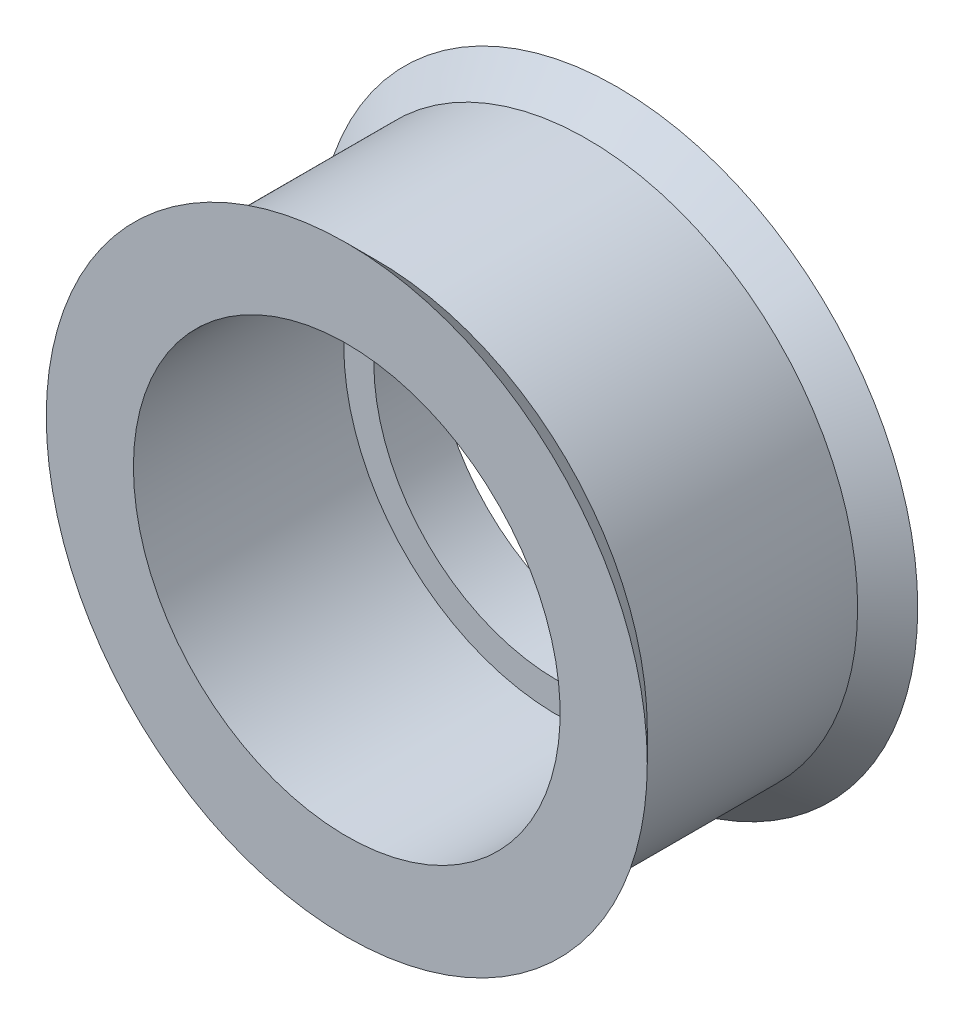
from build123d import *

# Parameters (mm, degrees)
SKETCH1_R           = 10
SKETCH1_R_2         = 9
SKETCH1_R_3         = 7.1
BOSS_EXTRUDE1_DEPTH = 4.5
SKETCH1_3_R         = 10
SKETCH1_3_R_2       = 9
CUT_EXTRUDE1_DEPTH  = 3.5
CHAMFER1_SIZE       = 1
SKETCH2_R           = 7.1
SKETCH2_R_2         = 6.1
BOSS_EXTRUDE2_DEPTH = 2


with BuildPart() as part:
    # Sketch1 → Boss-Extrude1 (new, symmetric)
    # profile 1 of 2: a face of its own
    with BuildSketch(Plane.XY):
        Circle(SKETCH1_R)
        Circle(SKETCH1_R_2, mode=Mode.SUBTRACT)
    # profile 2 of 2: a face of its own
    with BuildSketch(Plane.XY):
        Circle(SKETCH1_R_2)
        Circle(SKETCH1_R_3, mode=Mode.SUBTRACT)
    extrude(amount=BOSS_EXTRUDE1_DEPTH, both=True)

    # Sketch1<3> → Cut-Extrude1 (cut, symmetric)
    with BuildSketch(Plane.XY):
        Circle(SKETCH1_3_R)
        Circle(SKETCH1_3_R_2, mode=Mode.SUBTRACT)
    extrude(amount=CUT_EXTRUDE1_DEPTH, both=True, mode=Mode.SUBTRACT)

    # Chamfer1
    chamfer1_edges = [part.edges().sort_by_distance(p)[0] for p in [
        (-10, 0, -3.5),
        (-10, 0, 3.5),
    ]]
    chamfer(chamfer1_edges, length=CHAMFER1_SIZE - 0.0001)  # a hair under: the kernel refuses the full size

    # Sketch2 → Boss-Extrude2 (add)
    with BuildSketch(Plane(origin=(0, 0, -4.5), x_dir=(-1, 0, 0), z_dir=(0, 0, -1))):
        Circle(SKETCH2_R)
        Circle(SKETCH2_R_2, mode=Mode.SUBTRACT)
    extrude(amount=-BOSS_EXTRUDE2_DEPTH)


solid = part.part
